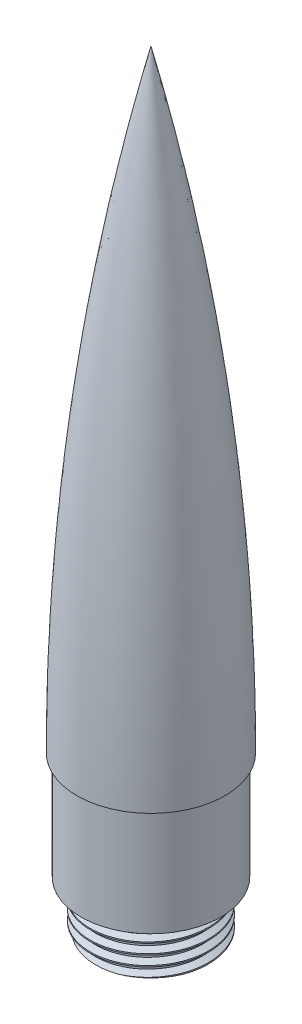
from build123d import *

# Parameters (mm, degrees)
SKETCH3_W               = 8.675
SKETCH3_H               = 22.225
BOSS_EXTRUDE1_START     = 9.525
SKETCH4_R               = 11.1125
SKETCH4_R_2             = 5.825
BOSS_EXTRUDE1_DEPTH     = 9.525
THREAD1_PITCH           = 2.116666667
THREAD1_FROM            = 2.116667
BOSS_EXTRUDE2_START     = -3.175
BOSS_EXTRUDE2_OUTLINE_R = 5.825
BOSS_EXTRUDE2_DEPTH     = 12.7
CHAMFER1_SIZE           = 1.5875


with BuildPart() as part:
    # Sketch3 → Revolve3 (revolve)
    with BuildSketch(Plane.XY, mode=Mode.PRIVATE) as revolve3_sk:
        with BuildLine():
            ThreePointArc((15.35, 22.225), (11.498586297, 86.187142123), (0, 149.225))
            Line((0, 149.225), (0, 60.172444493))
            ThreePointArc((0, 60.172444493), (3.258104384, 58.883582655), (4.752745709, 55.714599171))
            ThreePointArc((4.752745709, 55.714599171), (5.556867763, 38.978380121), (5.825, 22.225))
            Line((5.825, 22.225), (14.5, 22.225))
            Line((14.5, 22.225), (15.35, 22.225))
        make_face()
        with Locations((10.1625, 11.1125)):
            Rectangle(SKETCH3_W, SKETCH3_H)
    revolve(revolve3_sk.sketch.rotate(Axis((0, 149.225, 0), (0, -1, 0)), 180), axis=Axis((0, 149.225, 0), (0, -1, 0)))

    # Sketch4 → Boss-Extrude1 (add)
    with BuildSketch(Plane.XZ.offset(BOSS_EXTRUDE1_START)):
        with Locations(Location((0, 0, 0), (0, 0, 180))):
            Circle(SKETCH4_R)
        with Locations(Location((0, 0, 0), (0, 0, 180))):
            Circle(SKETCH4_R_2, mode=Mode.SUBTRACT)
    extrude(amount=-BOSS_EXTRUDE1_DEPTH)

    # Thread1: arcs per turn and ends read off the stored shape
    # Thread1: the profile of Thread Profile1 profile screwed along a right-hand helix through 7 turns, 10 arcs to a turn; built about Z, then put on its axis
    thread1_z = Axis((0, 0, 0), (0, 0, 1))
    thread1_corners = [(11.1122, 0, -0.000173205), (12.258179435, 0, 0.66145833), (12.258179435, 0, 0.926041664), (11.1122, 0, 1.587673199)]
    with BuildLine(mode=Mode.PRIVATE) as thread1_profile:
        Line(thread1_corners[0], thread1_corners[1])
        Line(thread1_corners[1], thread1_corners[2])
        Line(thread1_corners[2], thread1_corners[3])
        Line(thread1_corners[3], thread1_corners[0])
    thread1_cap = Face(thread1_profile.wire())
    thread1_turn_angles = [0, 18, 36, 54, 72, 90, 108, 126, 144, 162, 180, 198, 216, 234, 252, 270, 288, 306, 324, 342, 360]
    thread1_turn_weights = [1, 0.9510565162951535, 1, 0.9510565162951535, 1, 0.9510565162951535, 1, 0.9510565162951535, 1, 0.9510565162951535, 1, 0.9510565162951535, 1, 0.9510565162951535, 1, 0.9510565162951535, 1, 0.9510565162951535, 1, 0.9510565162951535, 1]
    thread1_turn_rails = [Edge.make_bspline([Vector(p[0], p[1], 0).rotate(thread1_z, thread1_turn_angles[k]) / thread1_turn_weights[k] + Vector(0, 0, p[2] + THREAD1_PITCH * thread1_turn_angles[k] / 360) for k in range(21)], [0, 0, 0, 1, 1, 2, 2, 3, 3, 4, 4, 5, 5, 6, 6, 7, 7, 8, 8, 9, 9, 10, 10, 10], 2, thread1_turn_weights) for p in thread1_corners]
    thread1_turn_sides = [Face.make_surface_from_curves(thread1_turn_rails[p[0]], thread1_turn_rails[p[1]]) for p in [(0, 1), (1, 2), (2, 3), (3, 0)]]
    thread1 = Plane(origin=(0, -11.641666582, 0), x_dir=(0, 0, -1), z_dir=(0, 1, 0)) * split(Solid(Shell([*[p.moved(Location((0, 0, THREAD1_PITCH * i))) for i in range(7) for p in thread1_turn_sides], thread1_cap, thread1_cap.rotate(thread1_z, 2520).moved(Location((0, 0, THREAD1_PITCH * 2520 / 360)))])), bisect_by=Plane.XY.offset(THREAD1_FROM), keep=Keep.TOP, mode=Mode.PRIVATE)
    add(thread1)


with BuildPart() as body_2:
    # Boss-Extrude2: read off the stored shape, not the designer's step
    # Boss-Extrude2 outline → Boss-Extrude2 (new body)
    with BuildSketch(Plane.XZ.offset(BOSS_EXTRUDE2_START)):
        Circle(BOSS_EXTRUDE2_OUTLINE_R)
    extrude(amount=BOSS_EXTRUDE2_DEPTH)

    # Chamfer1
    chamfer1_edges = [body_2.edges().sort_by_distance(p)[0] for p in [
        (-5.825, 3.175, 0),
    ]]
    chamfer(chamfer1_edges, length=CHAMFER1_SIZE)


solid = Compound([part.part, body_2.part])
